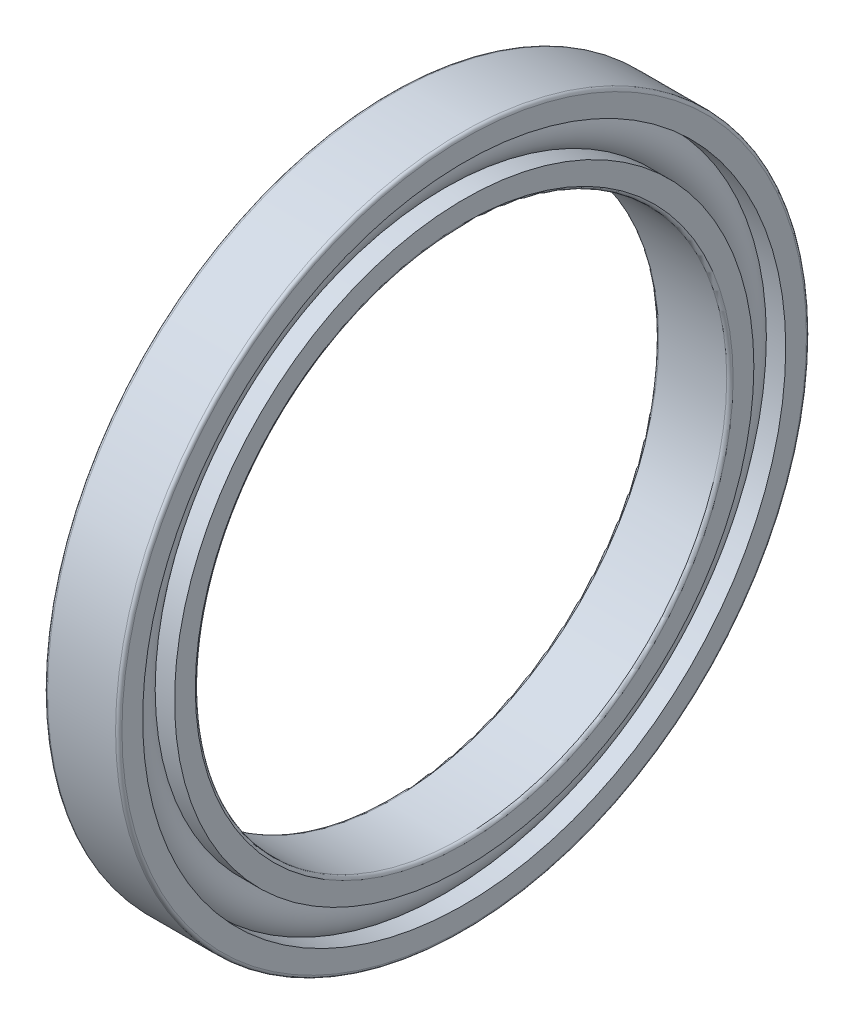
from build123d import *

# Parameters (mm, degrees)
CAGSPISKE_W     = 0.45
CAGSPISKE_H     = 0.75
CAGESPINE_ANGLE = 0.001
BALSIMSKE_R     = 2.25


with BuildPart() as part:
    # CagSpiSke → CageSpine (revolve)
    with BuildSketch(Plane.XY):
        with Locations((0, 28.75)):
            Rectangle(CAGSPISKE_W, CAGSPISKE_H)
    revolve(axis=Axis((-20.6375, 0, 0), (-1, 0, 0)), revolution_arc=CAGESPINE_ANGLE)

    # BalSimSke → BallsSimplified (revolve)
    with BuildSketch(Plane.XY):
        with Locations((0, 28.75)):
            Circle(BALSIMSKE_R)
    revolve(axis=Axis((-10, 0, 0), (1, 0, 0)))

    # InnRacSke → InnerRace (revolve)
    with BuildSketch(Plane.XY):
        with BuildLine():
            Line((-1.643357843, 27.25), (-3.5, 27.25))
            Line((-3.5, 27.25), (-3.5, 25.3))
            ThreePointArc((-3.5, 25.3), (-3.412132034, 25.087867966), (-3.2, 25))
            Line((-3.2, 25), (3.2, 25))
            ThreePointArc((3.2, 25), (3.412132034, 25.087867966), (3.5, 25.3))
            Line((3.5, 25.3), (3.5, 27.25))
            Line((3.5, 27.25), (1.643357843, 27.25))
            ThreePointArc((1.643357843, 27.25), (0, 26.525), (-1.643357843, 27.25))
        make_face()
    revolve(axis=Axis((-20.6375, 0, 0), (1, 0, 0)))

    # OutRacSke → OuterRace (revolve)
    with BuildSketch(Plane.XY):
        with BuildLine():
            Line((-1.643357843, 30.25), (-3.5, 30.25))
            Line((-3.5, 30.25), (-3.5, 32.2))
            ThreePointArc((-3.5, 32.2), (-3.412132034, 32.412132034), (-3.2, 32.5))
            Line((-3.2, 32.5), (3.2, 32.5))
            ThreePointArc((3.2, 32.5), (3.412132034, 32.412132034), (3.5, 32.2))
            Line((3.5, 32.2), (3.5, 30.25))
            Line((3.5, 30.25), (1.643357843, 30.25))
            ThreePointArc((1.643357843, 30.25), (0, 30.975), (-1.643357843, 30.25))
        make_face()
    revolve(axis=Axis((-20.6375, 0, 0), (1, 0, 0)))


solid = part.part
